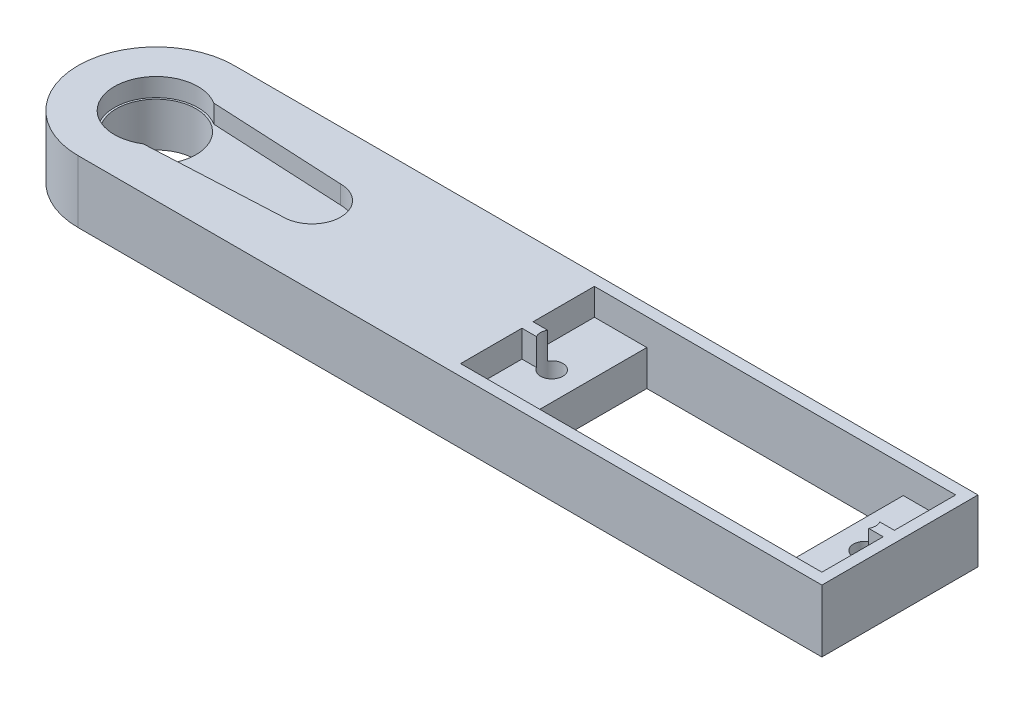
from build123d import *

# Parameters (mm, degrees)
BOSS_EXTRUDE1_DEPTH = 3.95
SKETCH2_R           = 3.575
CUT_EXTRUDE1_DEPTH  = 3.95
BOSS_EXTRUDE2_DEPTH = 1.64
SKETCH4_R           = 3.25
CUT_EXTRUDE2_DEPTH  = 63.643819328
CAVITY1_OUTLINE_R   = 3.25
CAVITY1_DEPTH       = 5.59
CAVITY1_START       = 3.19
CAVITY1_2_DEPTH     = 2.4
CUT_EXTRUDE4_DEPTH  = 63.643819328
BOSS_EXTRUDE3_START = -5.59
BOSS_EXTRUDE3_DEPTH = 5.59
BOSS_EXTRUDE4_DEPTH = 5.59
BOSS_EXTRUDE5_DEPTH = 5.59
CUT_EXTRUDE5_DEPTH  = 2.4
SKETCH7_R           = 1
CUT_EXTRUDE6_DEPTH  = 5.59


# Read off the part's stored shape, not the designer's step: Cavity1
with BuildPart() as part:
    # Sketch1 → Boss-Extrude1 (new body)
    with BuildSketch(Plane(origin=(0, 0, 0), x_dir=(1, 0, 0), z_dir=(0, 1, 0))):
        with BuildLine():
            Line((0, 7), (55, 7))
            ThreePointArc((55, 7), (62, 0), (55, -7))
            Line((55, -7), (0, -7))
            ThreePointArc((0, -7), (-7, 0), (0, 7))
        make_face()
    extrude(amount=BOSS_EXTRUDE1_DEPTH)

    # Sketch2 → Cut-Extrude1 (cut)
    with BuildSketch(Plane.XZ):
        with Locations(Location((0, 0, 0), (0, 0, 270))):
            Circle(SKETCH2_R)
    extrude(amount=-CUT_EXTRUDE1_DEPTH, mode=Mode.SUBTRACT)

    # Sketch3 → Boss-Extrude2 (add)
    with BuildSketch(Plane(origin=(0, 3.95, 0), x_dir=(1, 0, 0), z_dir=(0, 1, 0))):
        with BuildLine():
            Line((0, -7), (55, -7))
            ThreePointArc((55, -7), (62, 0), (55, 7))
            Line((55, 7), (0, 7))
            ThreePointArc((0, 7), (-7, 0), (0, -7))
        make_face()
        with BuildLine():
            Line((13.979308982, 2.569996388), (1.997926282, 3.167540934))
            ThreePointArc((1.997926282, 3.167540934), (-3.745, 0), (1.997926282, -3.167540934))
            Line((1.997926282, -3.167540934), (13.979308982, -2.569996388))
            ThreePointArc((13.979308982, -2.569996388), (16.545, 0), (13.979308982, 2.569996388))
        make_face(mode=Mode.SUBTRACT)
    extrude(amount=BOSS_EXTRUDE2_DEPTH)

    # Sketch4 → Cut-Extrude2 (cut, through all)
    with BuildSketch(Plane(origin=(0, 5.59, 0), x_dir=(1, 0, 0), z_dir=(0, 1, 0))):
        with Locations(Location((55, 0, 0), (0, 0, 270))):
            Circle(SKETCH4_R)
    extrude(amount=-CUT_EXTRUDE2_DEPTH, mode=Mode.SUBTRACT)

    # Cavity1 outline → Cavity1 (cut)
    with BuildSketch(Plane(origin=(0, 0, 0), x_dir=(1, 0, 0), z_dir=(0, 1, 0))):
        with BuildLine():
            Line((58.605551275, 6), (38, 6))
            Line((38, 6), (38, -6))
            Line((38, -6), (58.605551275, -6))
            ThreePointArc((58.605551275, -6), (59.949747468, -4.949747468), (61, -3.605551275))
            Line((61, -3.605551275), (61, 3.605551275))
            ThreePointArc((61, 3.605551275), (59.949747468, 4.949747468), (58.605551275, 6))
        make_face()
        with Locations((55, 0)):
            Circle(CAVITY1_OUTLINE_R, mode=Mode.SUBTRACT)
    extrude(amount=CAVITY1_DEPTH, mode=Mode.SUBTRACT)

    # Cavity1 2 outline → Cavity1 2 (cut)
    with BuildSketch(Plane(origin=(0, 0, 0), x_dir=(1, 0, 0), z_dir=(0, 1, 0)).offset(CAVITY1_START)):
        with BuildLine():
            Line((33.3, 0.5), (34.605619966, 0.5))
            ThreePointArc((34.605619966, 0.5), (36.47164537, 0), (34.605619966, -0.5))
            Line((34.605619966, -0.5), (33.3, -0.5))
            Line((33.3, -0.5), (33.3, -6))
            Line((33.3, -6), (38, -6))
            Line((38, -6), (38, 6))
            Line((38, 6), (33.3, 6))
            Line((33.3, 6), (33.3, 0.5))
        make_face()
        with BuildLine():
            ThreePointArc((61, -3.605551275), (62, 0), (61, 3.605551275))
            Line((61, 3.605551275), (61, -3.605551275))
        make_face()
    extrude(amount=CAVITY1_2_DEPTH, mode=Mode.SUBTRACT)

    # Sketch5 → Cut-Extrude4 (cut, through all)
    with BuildSketch(Plane.XZ):
        with BuildLine():
            Line((61, 3.605551275), (61, -3.605551275))
            ThreePointArc((61, -3.605551275), (62, 0), (61, 3.605551275))
        make_face()
    extrude(amount=-CUT_EXTRUDE4_DEPTH, mode=Mode.SUBTRACT)

    # Sketch6 → Boss-Extrude3 (add)
    with BuildSketch(Plane(origin=(0, 5.59, 0), x_dir=(1, 0, 0), z_dir=(0, 1, 0)).offset(BOSS_EXTRUDE3_START)):
        with BuildLine():
            Line((61, -6), (58.605551275, -6))
            ThreePointArc((58.605551275, -6), (56.870828693, -6.745368782), (55, -7))
            Line((55, -7), (66.7, -7))
            Line((66.7, -7), (66.7, 7))
            Line((66.7, 7), (55, 7))
            ThreePointArc((55, 7), (56.870828693, 6.745368782), (58.605551275, 6))
            Line((58.605551275, 6), (61, 6))
            Line((61, 6), (65.7, 6))
            Line((65.7, 6), (65.7, 0.5))
            Line((65.7, 0.5), (65.7, -0.5))
            Line((65.7, -0.5), (65.7, -6))
            Line((65.7, -6), (61, -6))
        make_face()
        with BuildLine():
            Line((58.605551275, -6), (33.3, -6))
            Line((33.3, -6), (33.3, -7))
            Line((33.3, -7), (55, -7))
            ThreePointArc((55, -7), (56.870828693, -6.745368782), (58.605551275, -6))
        make_face()
        with BuildLine():
            Line((33.3, 7), (33.3, 6))
            Line((33.3, 6), (58.605551275, 6))
            ThreePointArc((58.605551275, 6), (56.870828693, 6.745368782), (55, 7))
            Line((55, 7), (33.3, 7))
        make_face()
    extrude(amount=BOSS_EXTRUDE3_DEPTH)

    # Sketch6<3> → Boss-Extrude4 (add)
    with BuildSketch(Plane(origin=(0, 5.59, 0), x_dir=(1, 0, 0), z_dir=(0, 1, 0))):
        with BuildLine():
            Line((64.394380034, -0.5), (65.7, -0.5))
            Line((65.7, -0.5), (65.7, 0.5))
            Line((65.7, 0.5), (64.394380034, 0.5))
            ThreePointArc((64.394380034, 0.5), (62.52835463, 0), (64.394380034, -0.5))
        make_face()
    extrude(amount=-BOSS_EXTRUDE4_DEPTH)

    # Sketch6<5> → Boss-Extrude5 (add)
    with BuildSketch(Plane(origin=(0, 5.59, 0), x_dir=(1, 0, 0), z_dir=(0, 1, 0))):
        with BuildLine():
            Line((61, 6), (61, -6))
            Line((61, -6), (65.7, -6))
            Line((65.7, -6), (65.7, -0.5))
            Line((65.7, -0.5), (64.394380034, -0.5))
            ThreePointArc((64.394380034, -0.5), (62.52835463, 0), (64.394380034, 0.5))
            Line((64.394380034, 0.5), (65.7, 0.5))
            Line((65.7, 0.5), (65.7, 6))
            Line((65.7, 6), (61, 6))
        make_face()
    extrude(amount=-BOSS_EXTRUDE5_DEPTH)

    # Sketch6<6> → Cut-Extrude5 (cut)
    with BuildSketch(Plane(origin=(0, 5.59, 0), x_dir=(1, 0, 0), z_dir=(0, 1, 0))):
        with BuildLine():
            Line((61, 6), (61, -6))
            Line((61, -6), (65.7, -6))
            Line((65.7, -6), (65.7, -0.5))
            Line((65.7, -0.5), (64.394380034, -0.5))
            ThreePointArc((64.394380034, -0.5), (62.52835463, 0), (64.394380034, 0.5))
            Line((64.394380034, 0.5), (65.7, 0.5))
            Line((65.7, 0.5), (65.7, 6))
            Line((65.7, 6), (61, 6))
        make_face()
    extrude(amount=-CUT_EXTRUDE5_DEPTH, mode=Mode.SUBTRACT)

    # Sketch7 → Cut-Extrude6 (cut)
    with BuildSketch(Plane(origin=(0, 5.59, 0), x_dir=(1, 0, 0), z_dir=(0, 1, 0))):
        with Locations(Location((63.52835463, 0, 0), (0, 0, 270))):
            Circle(SKETCH7_R)
        with Locations(Location((35.47164537, 0, 0), (0, 0, 270))):
            Circle(SKETCH7_R)
    extrude(amount=-CUT_EXTRUDE6_DEPTH, mode=Mode.SUBTRACT)


solid = part.part
